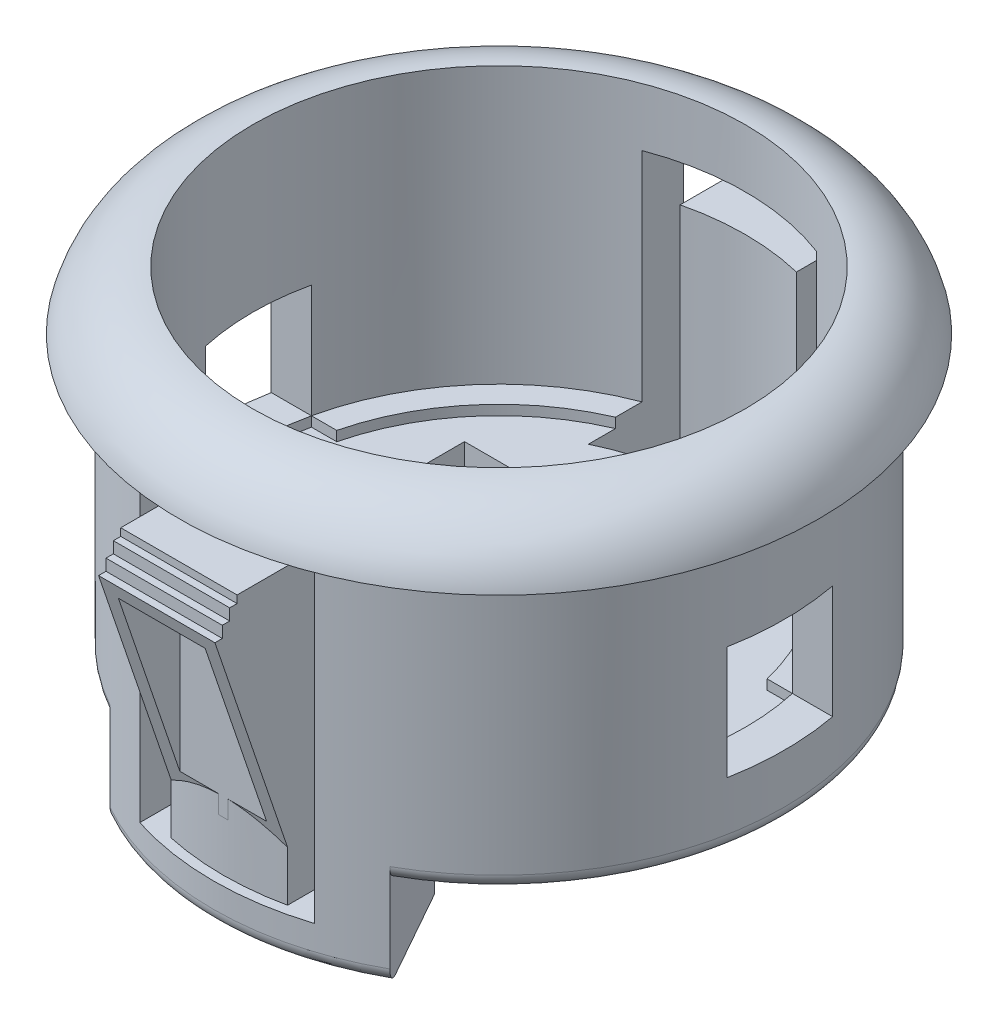
from build123d import *
from build123d.topology import SkipClean

# Parameters (mm, degrees)
FEET_DEPTH            = 4.572
SWITCH_HOLE_REACH     = 31.195
SKETCH2_W             = 12.954
SKETCH2_H             = 12.065
SQUARE_DEPTH          = 31.164446025
SQUARE_DEPTH_BACK     = 31.164446025
SKETCH6_W             = 5.461
SKETCH6_H             = 5.842
EXTRUDE3_START        = -0.508
SKETCH4_W             = 12.954
SKETCH4_H             = 12.065
EXTRUDE3_DEPTH        = 0.508
SKETCH5_W             = 15.621
SKETCH5_H             = 12.065
SWITCH_HOLE2_DEPTH    = 1.524
TAB_CIRC_CUTOUT_DEPTH = 17.066
TAB_START             = -6
TAB_TOP_OUTLINE_W     = 2.54
TAB_TOP_OUTLINE_H     = 1.905
TAB_TOP_DEPTH         = 6
TAB_WEDGE_DEPTH       = 3
SKETCH11_W            = 4.476
SKETCH11_H            = 10.247840718
CUT_TAB_DEPTH         = 3.556
FILLET1_R             = 0.762


# Read off the part's stored shape, not the designer's step: tab circ cutout, tab top
with BuildPart() as part:
    # Sketch1 → Revolve1 (revolve)
    with BuildSketch(Plane.XY, mode=Mode.PRIVATE) as revolve1_sk:
        with BuildLine():
            Line((14.732, 0), (16.51, 0))
            ThreePointArc((16.51, 0), (15.124670081, 2.159981002), (12.7, 3))
            Line((12.7, 3), (12.7, -11.224))
            Line((12.7, -11.224), (0, -11.224))
            Line((0, -11.224), (0, -14.526))
            Line((0, -14.526), (8.6995, -14.526))
            Line((8.6995, -14.526), (8.6995, -19.098))
            Line((8.6995, -19.098), (14.732, -19.098))
            Line((14.732, -19.098), (14.732, 0))
        make_face()
    revolve(revolve1_sk.sketch.rotate(Axis((0, 3, 0), (0, -1, 0)), 180), axis=Axis((0, 3, 0), (0, -1, 0)))

    # Sketch3 → feet (cut)
    with BuildSketch(Plane.XZ.offset(19.098)):
        with BuildLine():
            ThreePointArc((-7.2136, 12.845069055), (-14.732, 0), (-7.2136, -12.845069055))
            Line((-7.2136, -12.845069055), (-4.259755172, -7.585234744))
            ThreePointArc((-4.259755172, -7.585234744), (-8.6995, 0), (-4.259755172, 7.585234744))
            Line((-4.259755172, 7.585234744), (-7.2136, 12.845069055))
        make_face()
        with BuildLine():
            Line((4.259755172, -7.585234744), (7.2136, -12.845069055))
            ThreePointArc((7.2136, -12.845069055), (14.732, 0), (7.2136, 12.845069055))
            Line((7.2136, 12.845069055), (4.259755172, 7.585234744))
            ThreePointArc((4.259755172, 7.585234744), (8.6995, 0), (4.259755172, -7.585234744))
        make_face()
    extrude(amount=-FEET_DEPTH, mode=Mode.SUBTRACT)

    # Sketch2 → switch hole (cut, up to next)
    with BuildSketch(Plane.XZ.offset(14.526), mode=Mode.PRIVATE) as switch_hole_sk1:
        Rectangle(SKETCH2_W, SKETCH2_H)
    switch_hole_tool1 = extrude(switch_hole_sk1.sketch, amount=-SWITCH_HOLE_REACH, mode=Mode.PRIVATE) & part.part
    add(switch_hole_tool1.solids().sort_by_distance((0, -14.526, 0))[0], mode=Mode.SUBTRACT)

    # Sketch6 → square (cut, two sides: drawn at the far end of the back side and taken through both)
    with BuildSketch(Plane(origin=(0, 0, 0), x_dir=(0, 0, -1), z_dir=(1, 0, 0)).offset(-SQUARE_DEPTH_BACK)):
        with Locations((0, -8.303)):
            Rectangle(SKETCH6_W, SKETCH6_H)
    extrude(amount=SQUARE_DEPTH + SQUARE_DEPTH_BACK, mode=Mode.SUBTRACT)

    # Sketch4 → Extrude3 (cut)
    with BuildSketch(Plane(origin=(0, -11.224, 0), x_dir=(1, 0, 0), z_dir=(0, 1, 0)).offset(EXTRUDE3_START)):
        with BuildLine():
            Line((11.099066166, -2.7305), (12.402998418, -2.7305))
            ThreePointArc((12.402998418, -2.7305), (12.7, 0), (12.402998418, 2.7305))
            Line((12.402998418, 2.7305), (11.099066166, 2.7305))
            ThreePointArc((11.099066166, 2.7305), (0, 11.43), (-11.099066166, 2.7305))
            Line((-11.099066166, 2.7305), (-12.402998418, 2.7305))
            ThreePointArc((-12.402998418, 2.7305), (-12.7, 0), (-12.402998418, -2.7305))
            Line((-12.402998418, -2.7305), (-11.099066166, -2.7305))
            ThreePointArc((-11.099066166, -2.7305), (0, -11.43), (11.099066166, -2.7305))
        make_face()
        Rectangle(SKETCH4_W, SKETCH4_H, mode=Mode.SUBTRACT)
    extrude(amount=EXTRUDE3_DEPTH, mode=Mode.SUBTRACT)

    # Sketch5 → switch hole2 (cut)
    with BuildSketch(Plane(origin=(0, -11.732, 0), x_dir=(1, 0, 0), z_dir=(0, 1, 0))):
        Rectangle(SKETCH5_W, SKETCH5_H)
    extrude(amount=-SWITCH_HOLE2_DEPTH, mode=Mode.SUBTRACT)

    # tab circ cutout outline → tab circ cutout (cut)
    with BuildSketch(Plane.XZ):
        with BuildLine():
            ThreePointArc((-4.5, 9.109094357), (0, 10.16), (4.5, 9.109094357))
            Line((4.5, 9.109094357), (4.5, 14.027894496))
            ThreePointArc((4.5, 14.027894496), (0, 14.732), (-4.5, 14.027894496))
            Line((-4.5, 14.027894496), (-4.5, 9.109094357))
        make_face()
        with BuildLine():
            ThreePointArc((3, 12.340583455), (0, 12.7), (-3, 12.340583455))
            Line((-3, 12.340583455), (-3, 13.904034522))
            ThreePointArc((-3, 13.904034522), (0, 14.224), (3, 13.904034522))
            Line((3, 13.904034522), (3, 12.340583455))
        make_face(mode=Mode.SUBTRACT)
    tab_circ_cutout = extrude(amount=TAB_CIRC_CUTOUT_DEPTH, mode=Mode.SUBTRACT)

    # tab top outline → tab top (cut)
    with SkipClean():  # the faces are left unmerged after this step: merging them gives an invalid solid
        with BuildSketch(Plane(origin=(3, 0, 0), x_dir=(0, 0, -1), z_dir=(1, 0, 0)).offset(TAB_START)):
            with Locations((-13.610583455, -0.9525)):
                Rectangle(TAB_TOP_OUTLINE_W, TAB_TOP_OUTLINE_H)
        tab_top = extrude(amount=TAB_TOP_DEPTH, mode=Mode.SUBTRACT)
    add(part.part.scale(1), mode=Mode.REPLACE)  # the faces are merged on a copy

    # Sketch10 → tab wedge (add, symmetric)
    with BuildSketch(Plane(origin=(0, 0, 0), x_dir=(0, 0, -1), z_dir=(1, 0, 0))):
        Polygon((-13.904034522, -1.905), (-13.904034522, -14.478), (-17.651091727, -3.468159282), (-17.270091727, -3.468159282), (-17.270091727, -2.879362986), (-16.889091727, -2.879362986), (-16.889091727, -2.290566689), (-16.508091727, -2.290566689), (-16.508091727, -1.905), align=None)
    tab_wedge = extrude(amount=TAB_WEDGE_DEPTH, both=True)

    # Sketch11 → cut tab (cut)
    with BuildSketch(Plane.XY.offset(17.778091727)):
        with Locations((0, -9.354079641)):
            Rectangle(SKETCH11_W, SKETCH11_H)
    cut_tab = extrude(amount=-CUT_TAB_DEPTH, mode=Mode.SUBTRACT)

    # tab mirror: tab circ cutout, tab top, tab wedge, cut tab across plane
    add(tab_circ_cutout.mirror(Plane.XY), mode=Mode.SUBTRACT)
    add(tab_top.mirror(Plane.XY), mode=Mode.SUBTRACT)
    add(tab_wedge.mirror(Plane.XY))
    add(cut_tab.mirror(Plane.XY), mode=Mode.SUBTRACT)

    # Fillet1
    fillet1_edges = [part.edges().sort_by_distance(p)[0] for p in [
        (0, -19.098, -14.732),
        (14.732, -14.526, 0),
        (0, -19.098, 14.732),
        (-12.714216043, -14.526, -7.441809887),
    ]]
    fillet(fillet1_edges, radius=FILLET1_R)


solid = part.part
